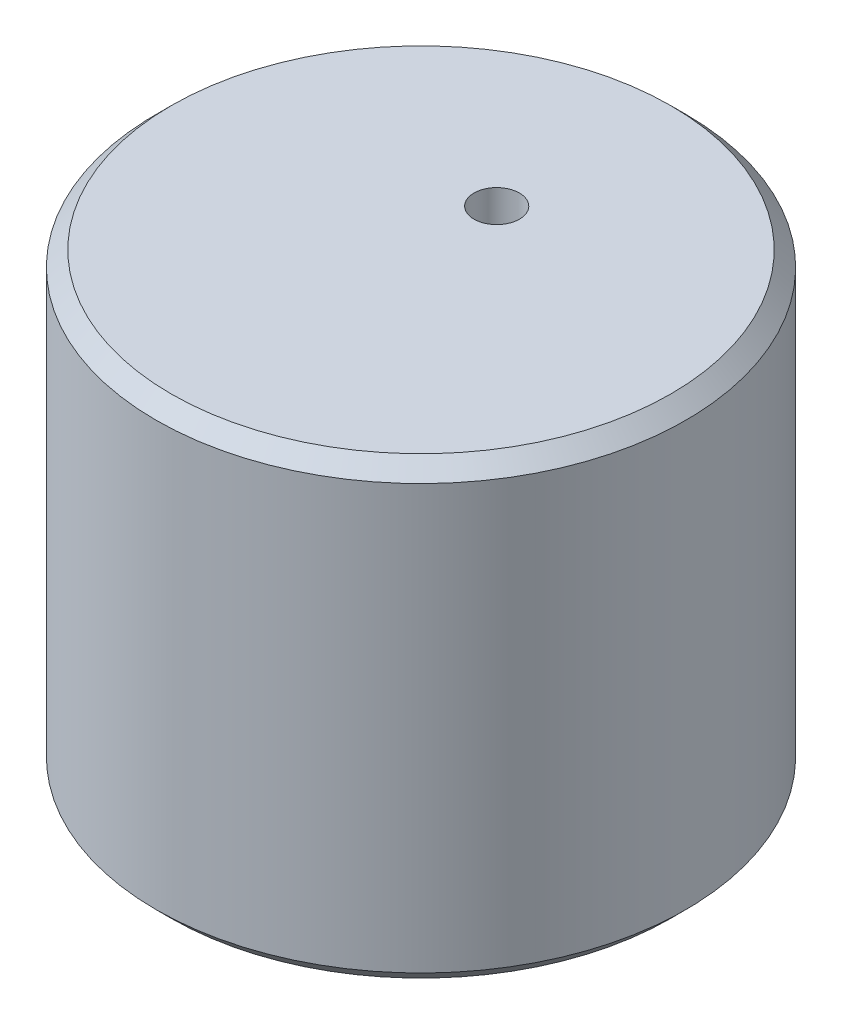
from build123d import *

# Parameters (mm, degrees)
SKETCH1_R           = 17.5
BOSS_EXTRUDE1_DEPTH = 30
BOSS_EXTRUDE2_DEPTH = 1
CHAMFER1_SIZE       = 1
SKETCH5_R           = 1.5
CUT_EXTRUDE1_DEPTH  = 10


with BuildPart() as part:
    # Sketch1 → Boss-Extrude1 (new body)
    with BuildSketch(Plane(origin=(0, 0, 0), x_dir=(1, 0, 0), z_dir=(0, 1, 0))):
        Circle(SKETCH1_R)
    extrude(amount=BOSS_EXTRUDE1_DEPTH)

    # Sketch2 → Boss-Extrude2 (add)
    with BuildSketch(Plane.XZ):
        Polygon((-1.5, 15), (1.5, 15), (1.5, 1.5), (15, 1.5), (15, -1.5), (1.5, -1.5), (1.5, -15), (-1.5, -15), (-1.5, -1.5), (-15, -1.5), (-15, 1.5), (-1.5, 1.5), align=None)
    extrude(amount=BOSS_EXTRUDE2_DEPTH)

    # Chamfer1
    chamfer1_edges = [part.edges().sort_by_distance(p)[0] for p in [
        (-17.5, 30, 0),
        (-17.5, 0, 0),
    ]]
    chamfer(chamfer1_edges, length=CHAMFER1_SIZE)

    # Sketch5 → Cut-Extrude1 (cut)
    with BuildSketch(Plane(origin=(0, 30, 0), x_dir=(1, 0, 0), z_dir=(0, 1, 0))):
        with Locations((0, 5)):
            Circle(SKETCH5_R)
    extrude(amount=-CUT_EXTRUDE1_DEPTH, mode=Mode.SUBTRACT)


solid = part.part
